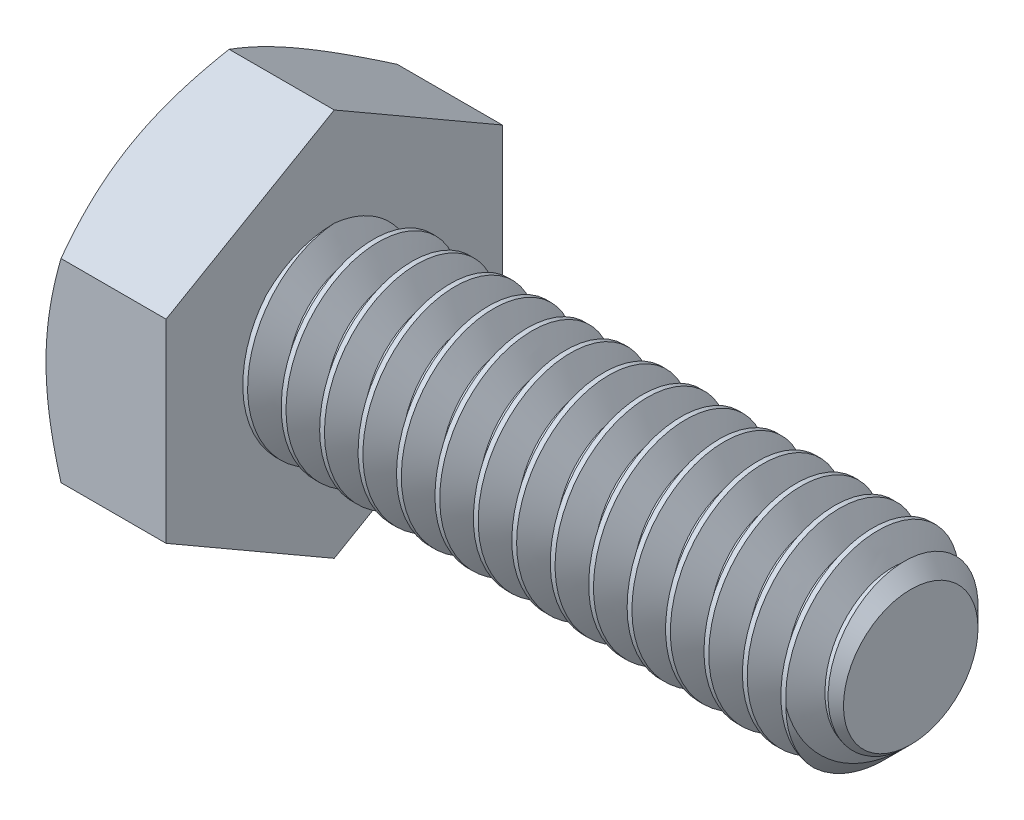
from build123d import *

# Parameters (mm, degrees)
SKETCH5_R           = 3.175
BOSS_EXTRUDE3_DEPTH = 19.05
CHAMFER1_SIZE       = 0.9525
CUT_SWEEP1_PITCH    = 1.27
BOSS_EXTRUDE4_DEPTH = 3.96875
SKETCH8_OUTSIDE_W   = 107.284
SKETCH8_OUTSIDE_H   = 109.004
SKETCH8_OUTSIDE_R   = 5.55625
CUT_EXTRUDE3_DEPTH  = 25.533595837
CUT_EXTRUDE3_DRAFT  = -60


with BuildPart() as part:
    # Sketch5 → Boss-Extrude3 (new body)
    with BuildSketch(Plane(origin=(11.509375, 0, 0), x_dir=(0, 0, -1), z_dir=(1, 0, 0))):
        Circle(SKETCH5_R)
    extrude(amount=-BOSS_EXTRUDE3_DEPTH)

    # Chamfer1
    chamfer1_edges = [part.edges().sort_by_distance(p)[0] for p in [
        (11.509375, 0, 3.175),
    ]]
    chamfer(chamfer1_edges, length=CHAMFER1_SIZE)

    # Cut-Sweep1: the profile of Sketch10 profile screwed along a right-hand helix of 16 turns, 8 arcs to a turn; built about Z, then put on its axis
    cut_sweep1_z = Axis((0, 0, 0), (0, 0, 1))
    cut_sweep1_corners = [(3.1753, 0, 0.000173205), (2.350110803, 0, -0.47625), (2.350110803, 0, -0.635), (3.1753, 0, -1.111423205)]
    with BuildLine(mode=Mode.PRIVATE) as cut_sweep1_profile:
        Line(cut_sweep1_corners[0], cut_sweep1_corners[1])
        Line(cut_sweep1_corners[1], cut_sweep1_corners[2])
        Line(cut_sweep1_corners[2], cut_sweep1_corners[3])
        Line(cut_sweep1_corners[3], cut_sweep1_corners[0])
    cut_sweep1_cap = Face(cut_sweep1_profile.wire())
    cut_sweep1_turn_angles = [0, 22.5, 45, 67.5, 90, 112.5, 135, 157.5, 180, 202.5, 225, 247.5, 270, 292.5, 315, 337.5, 360]
    cut_sweep1_turn_weights = [1, 0.9238795325112867, 1, 0.9238795325112867, 1, 0.9238795325112867, 1, 0.9238795325112867, 1, 0.9238795325112867, 1, 0.9238795325112867, 1, 0.9238795325112867, 1, 0.9238795325112867, 1]
    cut_sweep1_turn_rails = [Edge.make_bspline([Vector(p[0], p[1], 0).rotate(cut_sweep1_z, cut_sweep1_turn_angles[k]) / cut_sweep1_turn_weights[k] + Vector(0, 0, p[2] + CUT_SWEEP1_PITCH * cut_sweep1_turn_angles[k] / 360) for k in range(17)], [0, 0, 0, 1, 1, 2, 2, 3, 3, 4, 4, 5, 5, 6, 6, 7, 7, 8, 8, 8], 2, cut_sweep1_turn_weights) for p in cut_sweep1_corners]
    cut_sweep1_turn_sides = [Face.make_surface_from_curves(cut_sweep1_turn_rails[p[0]], cut_sweep1_turn_rails[p[1]]) for p in [(0, 1), (1, 2), (2, 3), (3, 0)]]
    cut_sweep1 = Plane(origin=(11.509375, 0, 0), x_dir=(0, 1, 0), z_dir=(-1, 0, 0)) * Solid(Shell([*[p.moved(Location((0, 0, CUT_SWEEP1_PITCH * i))) for i in range(16) for p in cut_sweep1_turn_sides], cut_sweep1_cap, cut_sweep1_cap.rotate(cut_sweep1_z, 5760).moved(Location((0, 0, CUT_SWEEP1_PITCH * 5760 / 360)))]))
    add(cut_sweep1, mode=Mode.SUBTRACT)

    # Sketch6 → Boss-Extrude4 (add)
    with BuildSketch(Plane.ZY.offset(7.540625)):
        Polygon((5.55625, 3.207902433), (0, 6.415804866), (-5.55625, 3.207902433), (-5.55625, -3.207902433), (0, -6.415804866), (5.55625, -3.207902433), align=None)
    extrude(amount=BOSS_EXTRUDE4_DEPTH)


with BuildPart() as cut_extrude3_tool:
    # Sketch8 outside → Cut-Extrude3 (with draft: the straight prism first)
    with BuildSketch(Plane.ZY.offset(11.509375)):
        Rectangle(SKETCH8_OUTSIDE_W, SKETCH8_OUTSIDE_H)
        Circle(SKETCH8_OUTSIDE_R, mode=Mode.SUBTRACT)
    extrude(amount=-CUT_EXTRUDE3_DEPTH)
    # Cut-Extrude3: the draft: its side faces are tilted about the plane it starts from
    cut_extrude3_sides = [cut_extrude3_tool.faces().sort_by_distance(p)[0] for p in [
        (1.257422919, -54.502, 0),
        (1.257422919, 0, 53.642),
        (1.257422919, 54.502, 0),
        (1.257422919, 0, -53.642),
        (1.257422919, 0, -5.55625),
    ]]
    draft(cut_extrude3_sides, Plane.ZY.offset(11.509375), CUT_EXTRUDE3_DRAFT)


with BuildPart() as part_1:
    add(part.part)

    # Cut-Extrude3: cut by cut_extrude3_tool
    add(cut_extrude3_tool.part, mode=Mode.SUBTRACT)


solid = part_1.part
